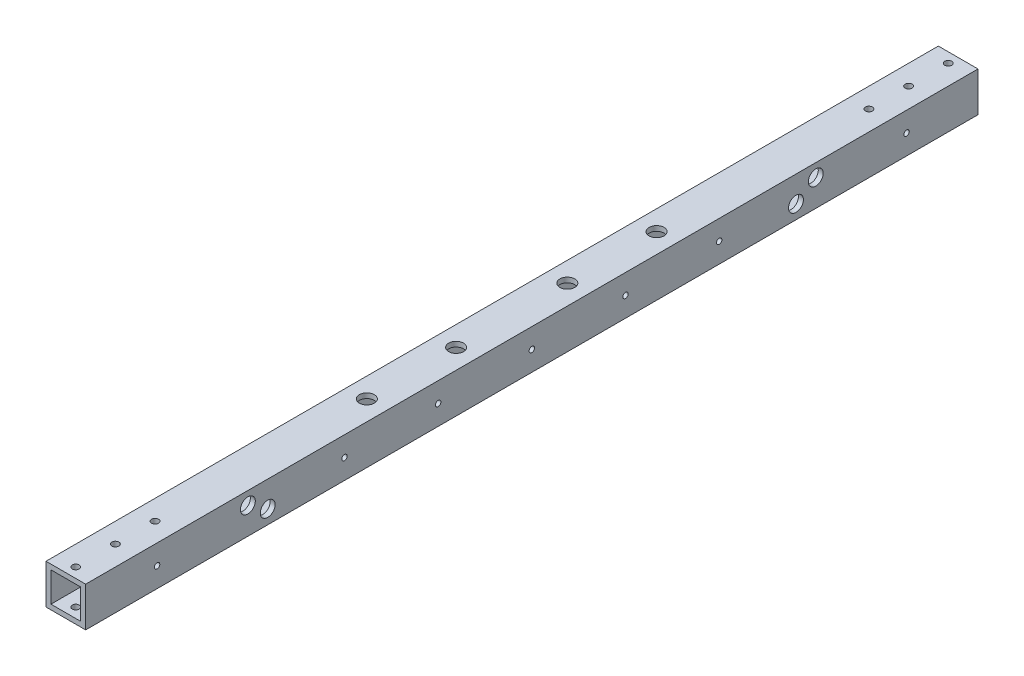
from build123d import *

# Parameters (mm, degrees)
SKETCH1_W                    = 25.4
SKETCH1_H                    = 25.4
SKETCH1_W_2                  = 19.05
SKETCH1_H_2                  = 19.05
EXTRUDE_THIN1_DEPTH          = 571.5
F_8_CLEARANCE_HOLE1_D        = 4.4958
F_8_32_TAPPED_HOLE1_D        = 3.4544
F_8_32_TAPPED_HOLE1_DEPTH    = 12.2936
F_8_32_TAPPED_HOLE1_TIP      = 1.037806461
F_3_8_0_375_DIAMETER_HOLE2_D = 9.525
F_3_8_0_375_DIAMETER_HOLE3_D = 9.525


with BuildPart() as part:
    # Sketch1 → Extrude-Thin1 (new body)
    with BuildSketch(Plane.XY):
        Rectangle(SKETCH1_W, SKETCH1_H)
        Rectangle(SKETCH1_W_2, SKETCH1_H_2, mode=Mode.SUBTRACT)
    extrude(amount=EXTRUDE_THIN1_DEPTH)

    # #8 Clearance Hole1 (through all)
    with Locations(Plane(origin=(0, 12.7, 565.15), x_dir=(0, 0, 1), z_dir=(0, 1, 0))):
        with Locations((0, 0), (-558.8, 0), (-533.4, 0), (-508, 0), (-25.4, 0), (-50.8, 0)):
            Hole(F_8_CLEARANCE_HOLE1_D / 2)

    # #8-32 Tapped Hole1
    with Locations(Plane(origin=(12.7, -82.55, 285.75), x_dir=(0, 0, -1), z_dir=(1, 0, 0))):
        with Locations((-240, 82.55), (-120, 82.55), (-60, 82.55), (0, 82.55), (60, 82.55), (120, 82.55), (240, 82.55)):
            Hole(F_8_32_TAPPED_HOLE1_D / 2, depth=F_8_32_TAPPED_HOLE1_DEPTH)
            with Locations((0, 0, -(F_8_32_TAPPED_HOLE1_DEPTH + F_8_32_TAPPED_HOLE1_TIP / 2))):  # 118° drill point
                Cone(0, F_8_32_TAPPED_HOLE1_D / 2, F_8_32_TAPPED_HOLE1_TIP, mode=Mode.SUBTRACT)

    # 3/8 (0.375) Diameter Hole2 (through all)
    with Locations(Plane(origin=(-12.7, -82.55, 285.75), x_dir=(0, 0, -1), z_dir=(-1, 0, 0))):
        with Locations((-181.864, -86.995), (-169.164, -78.74), (169.164, -78.74), (181.864, -86.995), (181.864, -57.15), (-181.864, -57.15)):
            Hole(F_3_8_0_375_DIAMETER_HOLE2_D / 2)

    # 3/8 (0.375) Diameter Hole3 (through all)
    with Locations(Plane(origin=(-346.075, 12.7, 285.75), x_dir=(0, 0, 1), z_dir=(0, 1, 0))):
        with Locations((-92.583, 346.075), (-35.433, 346.075), (35.814, 346.075), (92.964, 346.075), (-22.9616, -346.775), (50.0634, -346.775), (123.0884, -346.775), (-381, 114.3), (-381, 98.425), (-381, 82.55), (-381, -114.3), (-381, -130.175), (-381, -146.05)):
            Hole(F_3_8_0_375_DIAMETER_HOLE3_D / 2)


solid = part.part
